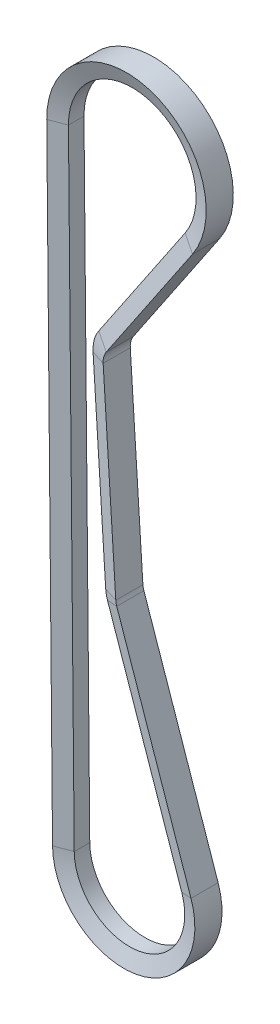
from build123d import *


with BuildPart() as part:
    # Sweep1: sweep along a path in Sketch2
    with BuildLine(Plane.XY) as sweep1_path:
        Line((24.176123312, 204.336002976), (-6.148709248, 159.396279131))
        ThreePointArc((-6.148709248, 159.396279131), (-7.013222158, 157.507957204), (-7.222223349, 155.441689851))
        Line((-7.222223349, 155.441689851), (-2.783015296, 85.582592864))
        ThreePointArc((-2.783015296, 85.582592864), (-2.672345351, 84.739259436), (-2.449959789, 83.918282111))
        Line((-2.449959789, 83.918282111), (23.638435343, 8.137835986))
        ThreePointArc((23.638435343, 8.137835986), (4.239416018, -24.637925071), (-24.998931527, -0.231133056))
        Line((-24.998931527, -0.231133056), (-27.032713306, 219.739009762))
        ThreePointArc((-27.032713306, 219.739009762), (9.031214557, 246.811192008), (24.176123312, 204.336002976))
    # Sketch3 → Sweep1 (sweep)
    with BuildSketch(Plane(origin=(23.638435343, 8.137835986, 0), x_dir=(0, 0, -1), z_dir=(0.32551343944939787, -0.9455374137165717, 0))):
        Polygon((-4.7625, 0), (4.7625, 0), (2.728634331, -5.588), (-2.728634331, -5.588), align=None)
    sweep(path=sweep1_path.line)


solid = part.part
